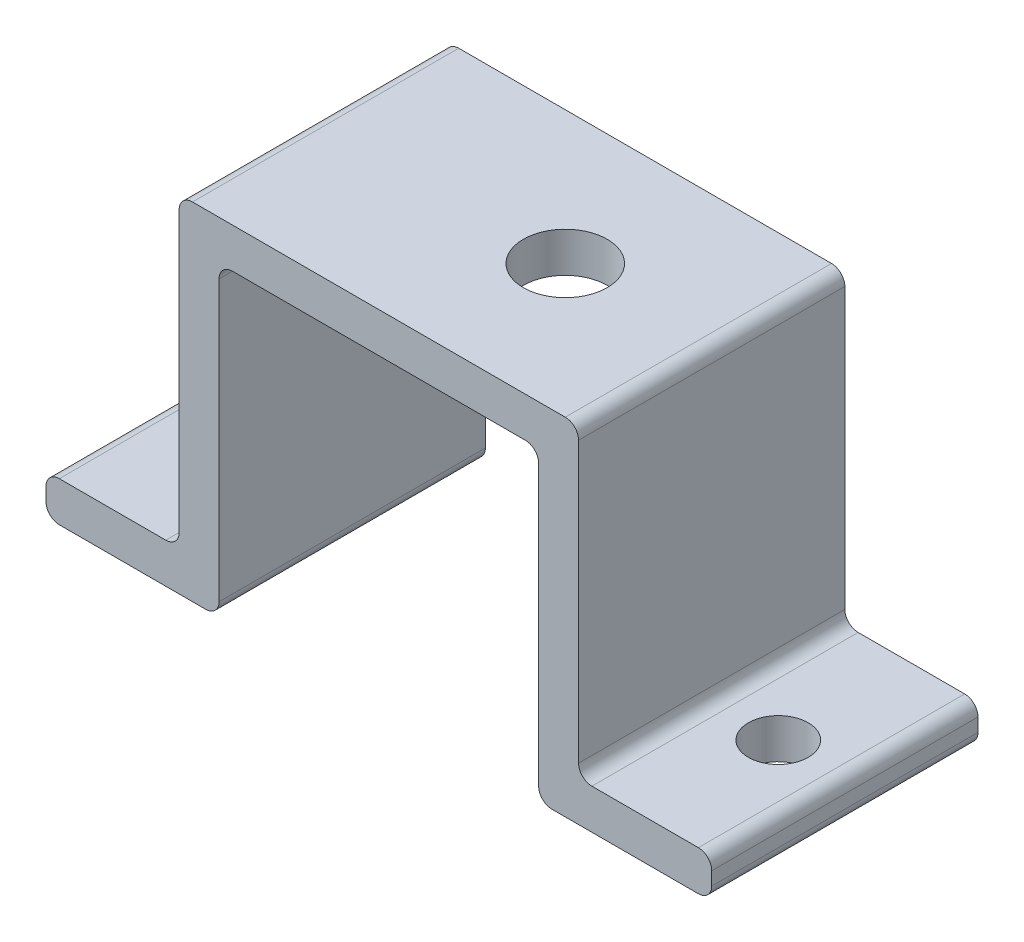
from build123d import *

# Parameters (mm, degrees)
BOSS_EXTRUDE1_DEPTH = 20
SKETCH3_R           = 3.15
CUT_EXTRUDE1_DEPTH  = 42.243181255
SKETCH5_R           = 2.25
CUT_EXTRUDE2_DEPTH  = 40.420806689
FILLET1_R           = 1


with BuildPart() as part:
    # Sketch2 → Boss-Extrude1 (new body)
    with BuildSketch(Plane.XY):
        Polygon((-12, 0), (12, 0), (12, -23), (25, -23), (25, -20), (15, -20), (15, 3), (-15, 3), (-15, -20), (-25, -20), (-25, -23), (-12, -23), align=None)
    extrude(amount=BOSS_EXTRUDE1_DEPTH)

    # Sketch3 → Cut-Extrude1 (cut, through all)
    with BuildSketch(Plane(origin=(0, 3, 0), x_dir=(1, 0, 0), z_dir=(0, 1, 0))):
        with Locations((4, -10)):
            Circle(SKETCH3_R)
    extrude(amount=-CUT_EXTRUDE1_DEPTH, mode=Mode.SUBTRACT)

    # Sketch5 → Cut-Extrude2 (cut, through all)
    with BuildSketch(Plane(origin=(0, -20, 0), x_dir=(1, 0, 0), z_dir=(0, 1, 0))):
        with Locations((-20, -10)):
            Circle(SKETCH5_R)
        with Locations((20, -10)):
            Circle(SKETCH5_R)
    extrude(amount=-CUT_EXTRUDE2_DEPTH, mode=Mode.SUBTRACT)

    # Fillet1
    fillet1_edges = [part.edges().sort_by_distance(p)[0] for p in [
        (25, -20, 10),
        (-25, -23, 10),
        (25, -23, 10),
        (-25, -20, 10),
        (-15, -20, 10),
        (-15, 3, 10),
        (15, 3, 10),
        (15, -20, 10),
        (12, -23, 10),
        (-12, -23, 10),
        (-12, 0, 10),
        (12, 0, 10),
    ]]
    fillet(fillet1_edges, radius=FILLET1_R)


solid = part.part
